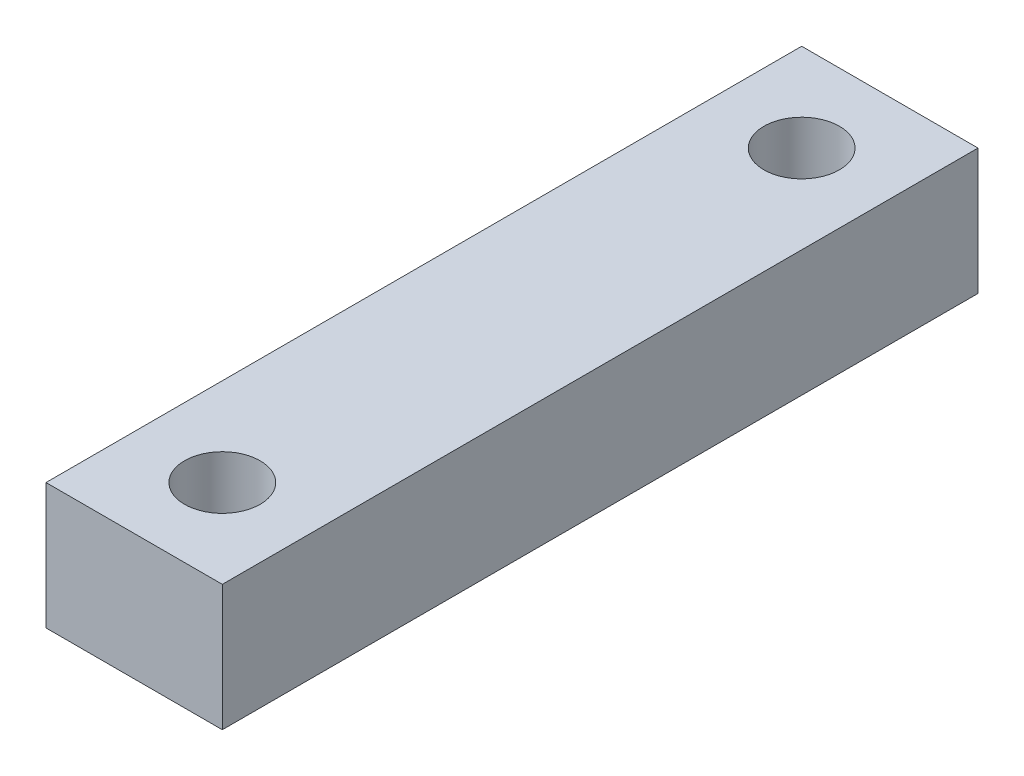
from build123d import *

# Parameters (mm, degrees)
SCHIZZO1_W                   = 7
SCHIZZO1_H                   = 5
ESTRUSIONE_ESTRUSIONE1_DEPTH = 30
SCHIZZO2_R                   = 1.5
TAGLIO_ESTRUSIONE1_DEPTH     = 32.208973069


with BuildPart() as part:
    # Schizzo1 → Estrusione-Estrusione1 (new body)
    with BuildSketch(Plane.XY):
        with Locations((-3.5, 2.5)):
            Rectangle(SCHIZZO1_W, SCHIZZO1_H)
    extrude(amount=ESTRUSIONE_ESTRUSIONE1_DEPTH)

    # Schizzo2 → Taglio-Estrusione1 (cut, through all)
    with BuildSketch(Plane(origin=(0, 0, 0), x_dir=(-1, 0, 0), z_dir=(0, -1, 0))):
        with Locations((3.5, -26.5)):
            Circle(SCHIZZO2_R)
        with Locations((3.5, -3.5)):
            Circle(SCHIZZO2_R)
    extrude(amount=-TAGLIO_ESTRUSIONE1_DEPTH, mode=Mode.SUBTRACT)


solid = part.part
